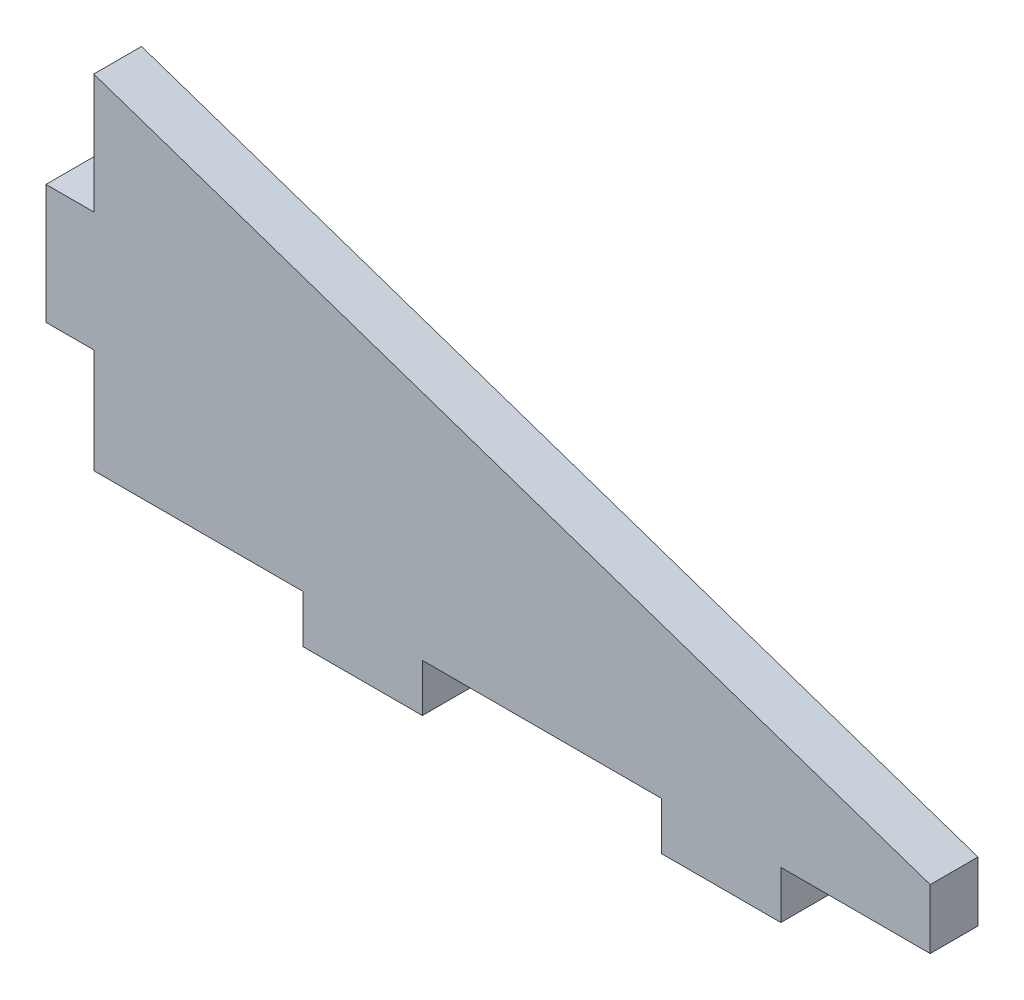
from build123d import *

# Parameters (mm, degrees)
SKETCH1_W           = 685
SKETCH1_H           = 250
BASE_FLANGE1_DEPTH  = 8
SKETCH6_W           = 60
SKETCH6_H           = 8
SKETCH6_W_2         = 70
EXTRUDE1_DEPTH      = 8
SKETCH7_W           = 250
SKETCH7_H           = 73.5
BASE_FLANGE2_DEPTH  = 8
SKETCH12_W          = 30.5
SKETCH12_H          = 8.5
EXTRUDE2_DEPTH      = 699.681794525
SKETCH14_W          = 250
SKETCH14_H          = 8
BASE_FLANGE3_DEPTH  = 50.5
SKETCH19_W          = 60
SKETCH19_H          = 8
SKETCH19_W_2        = 70
EXTRUDE3_DEPTH      = 8
BREAK_CORNER1_START = 41.5
BREAK_CORNER1_DEPTH = 8
EXTRUDE4_DEPTH      = 8
BASE_FLANGE4_DEPTH  = 8
SKETCH38_W          = 8.5
SKETCH38_H          = 20.5
EXTRUDE5_DEPTH      = 10
SKETCH39_W          = 20.5
SKETCH39_H          = 8.5
EXTRUDE6_DEPTH      = 10


# Read off the part's stored shape, not the designer's step: Break-Corner1
# Sheet-metal steps are written as plain solids
with BuildPart() as part:
    # Sketch1 → Base-Flange1 (new body)
    with BuildSketch(Plane(origin=(0, 0, 0), x_dir=(1, 0, 0), z_dir=(0, 1, 0))):
        Rectangle(SKETCH1_W, SKETCH1_H)
    extrude(amount=-BASE_FLANGE1_DEPTH)

    # Sketch6 → Extrude1 (cut)
    with BuildSketch(Plane(origin=(342.5, 0, 0), x_dir=(0, 0, -1), z_dir=(1, 0, 0))):
        with Locations((-95, -4)):
            Rectangle(SKETCH6_W, SKETCH6_H)
        with Locations((95, -4)):
            Rectangle(SKETCH6_W, SKETCH6_H)
        with Locations((0, -4)):
            Rectangle(SKETCH6_W_2, SKETCH6_H)
    extrude1 = extrude(amount=-EXTRUDE1_DEPTH, mode=Mode.SUBTRACT)

    # Mirror1: Extrude1 across plane
    add(extrude1.mirror(Plane(origin=(0, 0, 0), x_dir=(0, 0, 1), z_dir=(1, 0, 0))), mode=Mode.SUBTRACT)

    # Sketch39 → Extrude6 (cut)
    with BuildSketch(Plane.XZ.offset(8)):
        with Locations((289.5, 0)):
            Rectangle(SKETCH39_W, SKETCH39_H)
        with Locations((229.5, 0)):
            Rectangle(SKETCH39_W, SKETCH39_H)
        with Locations((-289.5, 0)):
            Rectangle(SKETCH39_W, SKETCH39_H)
        with Locations((-229.5, 0)):
            Rectangle(SKETCH39_W, SKETCH39_H)
    extrude(amount=-EXTRUDE6_DEPTH, mode=Mode.SUBTRACT)


with BuildPart() as body_2:
    # Sketch7 → Base-Flange2 (new body)
    with BuildSketch(Plane(origin=(334.5, 0, 0), x_dir=(0, 0, -1), z_dir=(1, 0, 0))):
        with Locations((0, 20.75)):
            Rectangle(SKETCH7_W, SKETCH7_H)
    extrude(amount=BASE_FLANGE2_DEPTH)

    # Sketch12 → Extrude2 (cut, through all)
    with BuildSketch(Plane(origin=(342.5, 0, 0), x_dir=(0, 0, -1), z_dir=(1, 0, 0))):
        with Locations((-50, -4)):
            Rectangle(SKETCH12_W, SKETCH12_H)
        with Locations((50, -4)):
            Rectangle(SKETCH12_W, SKETCH12_H)
        with Locations((50, 45.5)):
            Rectangle(SKETCH12_W, SKETCH12_H)
        with Locations((-50, 45.5)):
            Rectangle(SKETCH12_W, SKETCH12_H)
    extrude(amount=-EXTRUDE2_DEPTH, mode=Mode.SUBTRACT)

    # Sketch38 → Extrude5 (cut)
    with BuildSketch(Plane(origin=(342.5, 0, 0), x_dir=(0, 0, -1), z_dir=(1, 0, 0))):
        with Locations((0, 27.5)):
            Rectangle(SKETCH38_W, SKETCH38_H)
    extrude(amount=-EXTRUDE5_DEPTH, mode=Mode.SUBTRACT)


with BuildPart() as body_3:
    # Sketch14 → Base-Flange3 (new body)
    with BuildSketch(Plane.ZY.offset(-334.5)):
        with Locations((0, 45.5)):
            Rectangle(SKETCH14_W, SKETCH14_H)
    extrude(amount=-BASE_FLANGE3_DEPTH)

    # Sketch19 → Extrude3 (cut)
    with BuildSketch(Plane(origin=(342.5, 0, 0), x_dir=(0, 0, -1), z_dir=(1, 0, 0))):
        with Locations((95, 45.5)):
            Rectangle(SKETCH19_W, SKETCH19_H)
        with Locations((0, 45.5)):
            Rectangle(SKETCH19_W_2, SKETCH19_H)
        with Locations((-95, 45.5)):
            Rectangle(SKETCH19_W, SKETCH19_H)
    extrude(amount=-EXTRUDE3_DEPTH, mode=Mode.SUBTRACT)

    # Break-Corner1 outline → Break-Corner1 (cut)
    with BuildSketch(Plane(origin=(0, 0, 0), x_dir=(1, 0, 0), z_dir=(0, 1, 0)).offset(BREAK_CORNER1_START)):
        Polygon((385, -125), (385, -110), (370, -125), align=None)
        Polygon((370, 125), (385, 110), (385, 125), align=None)
    extrude(amount=BREAK_CORNER1_DEPTH, mode=Mode.SUBTRACT)

    # Sketch20 → Extrude4 (cut)
    with BuildSketch(Plane(origin=(0, 49.5, 0), x_dir=(1, 0, 0), z_dir=(0, 1, 0))):
        with BuildLine():
            Line((367, 75), (367, 55))
            ThreePointArc((367, 55), (362.5, 50.5), (358, 55))
            Line((358, 55), (358, 75))
            ThreePointArc((358, 75), (362.5, 79.5), (367, 75))
        make_face()
        with BuildLine():
            Line((367, -75), (367, -55))
            ThreePointArc((367, -55), (362.5, -50.5), (358, -55))
            Line((358, -55), (358, -75))
            ThreePointArc((358, -75), (362.5, -79.5), (367, -75))
        make_face()
    extrude(amount=-EXTRUDE4_DEPTH, mode=Mode.SUBTRACT)


with BuildPart() as body_4:
    # Mirror4: mirrored copy
    add(body_3.part.mirror(Plane(origin=(0, 0, 0), x_dir=(0, 0, 1), z_dir=(1, 0, 0))))


with BuildPart() as body_5:
    # Sketch29 → Base-Flange4 (new body)
    with BuildSketch(Plane.XY.offset(4)):
        Polygon((219.5, 0), (219.5, -8), (239.5, -8), (239.5, 0), (279.5, 0), (279.5, -8), (299.5, -8), (299.5, 0), (334.5, 0), (334.5, 17.5), (342.5, 17.5), (342.5, 37.5), (334.5, 37.5), (334.5, 57.5), (194.5, 10), (194.5, 0), align=None)
    extrude(amount=-BASE_FLANGE4_DEPTH)


with BuildPart() as body_6:
    # Mirror5: mirrored copy
    add(body_5.part.mirror(Plane(origin=(0, 0, 0), x_dir=(0, 0, 1), z_dir=(1, 0, 0))))


with BuildPart() as body_7:
    # Mirror3: mirrored copy
    add(body_2.part.mirror(Plane(origin=(0, 0, 0), x_dir=(0, 0, 1), z_dir=(1, 0, 0))))


solid = body_6.part
